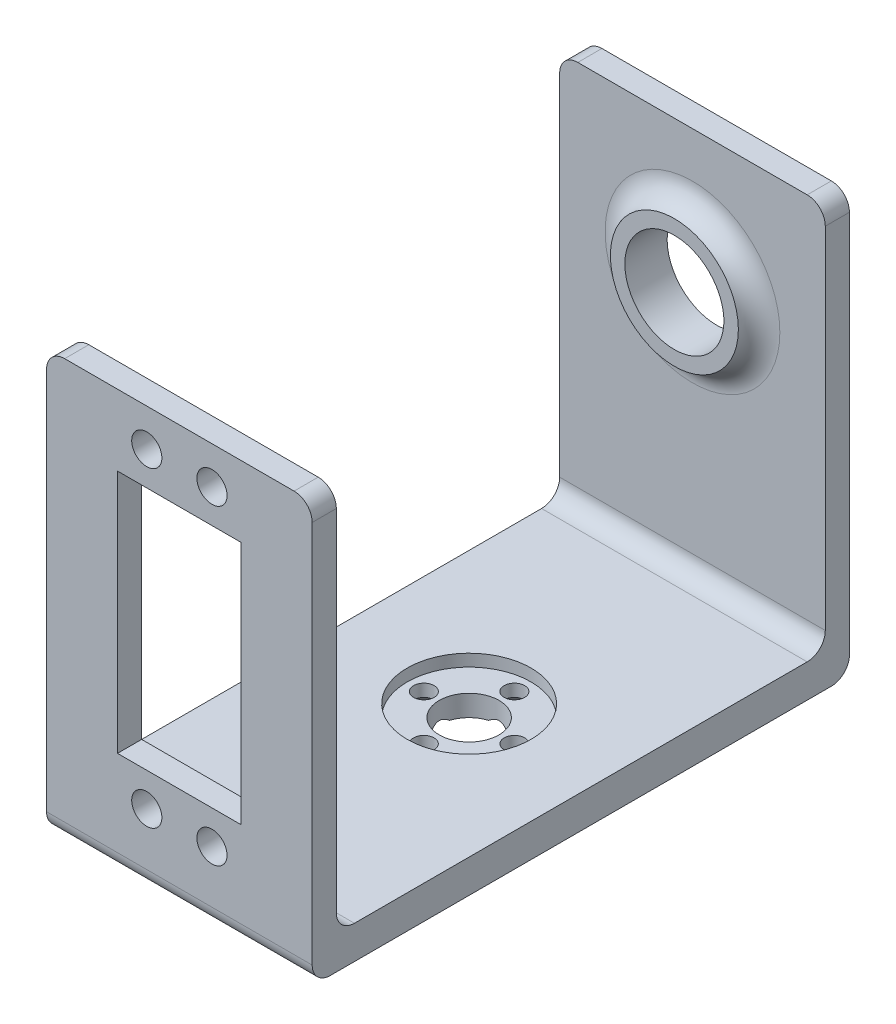
from build123d import *

# Parameters (mm, degrees)
BOSS_EXTRU_1_START                             = -3
ESQUISSE1_W                                    = 44
ESQUISSE1_H                                    = 64
ESQUISSE1_W_2                                  = 20.5
ESQUISSE1_H_2                                  = 40.5
BOSS_EXTRU_1_DEPTH                             = 4
BOSS_EXTRU_2_DEPTH                             = 44
ENL_V_MAT_EXTRU_1_REACH                        = 103.741
ESQUISSE3_R                                    = 8.2
ESQUISSE4_R                                    = 10.6
ESQUISSE4_R_2                                  = 8.2
BOSS_EXTRU_3_DEPTH                             = 3
CONG_1_R                                       = 4
CONG_2_R                                       = 3
ENL_V_MAT_EXTRU_2_REACH                        = 100.261
ESQUISSE5_R                                    = 2.5
ENL_V_START                                    = -2
ESQUISSE6_R                                    = 10.25
ENL_V_MAT_EXTRU_3_DEPTH                        = 2
ENL_V_MAT_EXTRU_4_REACH                        = 121.659
ESQUISSE7_R                                    = 4.95
FRAISAGE_POUR_VIS_T_TE_FRAIS_E_M31_D           = 3.4
FRAISAGE_POUR_VIS_T_TE_FRAIS_E_M31_CSINK_D     = 6.3
FRAISAGE_POUR_VIS_T_TE_FRAIS_E_M31_CSINK_ANGLE = 90


with BuildPart() as part:
    # Esquisse1 → Boss.-Extru.1 (new body)
    with BuildSketch(Plane.XY.offset(BOSS_EXTRU_1_START)):
        with Locations((-10, 0)):
            Rectangle(ESQUISSE1_W, ESQUISSE1_H)
        with Locations((-10, 0)):
            Rectangle(ESQUISSE1_W_2, ESQUISSE1_H_2, mode=Mode.SUBTRACT)
    extrude(amount=-BOSS_EXTRU_1_DEPTH)

    # Esquisse2 → Boss.-Extru.2 (add)
    with BuildSketch(Plane(origin=(12, 0, 0), x_dir=(0, 0, -1), z_dir=(1, 0, 0))):
        Polygon((3, -37.5), (92, -37.5), (92, 32), (88, 32), (88, -32), (7, -32), (7, -28.443383769), (3, -28.443383769), (3, -32), align=None)
    extrude(amount=-BOSS_EXTRU_2_DEPTH)

    # Esquisse3 → Enlèv. mat.-Extru.1 (cut, up to next)
    with BuildSketch(Plane(origin=(0, 0, -92), x_dir=(-1, 0, 0), z_dir=(0, 0, -1)), mode=Mode.PRIVATE) as enl_v_mat_extru_1_sk1:
        with Locations((10, 10)):
            Circle(ESQUISSE3_R)
    enl_v_mat_extru_1_tool1 = extrude(enl_v_mat_extru_1_sk1.sketch, amount=-ENL_V_MAT_EXTRU_1_REACH, mode=Mode.PRIVATE) & part.part
    add(enl_v_mat_extru_1_tool1.solids().sort_by_distance((-10, 10, -92))[0], mode=Mode.SUBTRACT)

    # Esquisse4 → Boss.-Extru.3 (add)
    with BuildSketch(Plane.XY.offset(-88)):
        with Locations((-10, 10)):
            Circle(ESQUISSE4_R)
        with Locations(Location((-10, 10, 0), (0, 0, 180))):
            Circle(ESQUISSE4_R_2, mode=Mode.SUBTRACT)
    extrude(amount=BOSS_EXTRU_3_DEPTH)

    # Congé1
    # the kernel refuses this fillet: 4 mm, written as the material it adds along each edge
    with BuildSketch(Plane(origin=(-10, 10, -88), x_dir=(1, 0, 0), z_dir=(0, -1, 0))) as cong_1_piece_1:
        with BuildLine():
            CenterArc((14.472983346, 4), CONG_1_R, 194.477512186, 75.522487814)
            Line((10.6, 3), (10.522540333, 2.98))
            ThreePointArc((10.522540333, 2.98), (10.52, 1.5), (10.52, 0))
            Line((10.52, 0), (10.6, -0.08))
            Line((10.6, -0.08), (14.472983346, -0.08))
            Line((14.472983346, -0.08), (14.472983346, 0))
        make_face()
    revolve(axis=Axis((-10, 10, -88), (0, 0, 1)))

    # Congé2
    cong_2_edges = [part.edges().sort_by_distance(p)[0] for p in [
        (12, 32, -90),
        (-32, 32, -90),
        (-10, -32, -88),
        (-10, -37.5, -3),
        (-10, -37.5, -92),
        (-10, -32, -7),
        (-32, 32, -5),
        (12, 32, -5),
    ]]
    fillet(cong_2_edges, radius=CONG_2_R)

    # Esquisse5 → Enlèv. mat.-Extru.2 (cut, up to next)
    with BuildSketch(Plane(origin=(0, 0, -7), x_dir=(-1, 0, 0), z_dir=(0, 0, -1)), mode=Mode.PRIVATE) as enl_v_mat_extru_2_sk1:
        with Locations((4.6, 25.8)):
            Circle(ESQUISSE5_R)
    enl_v_mat_extru_2_tool1 = extrude(enl_v_mat_extru_2_sk1.sketch, amount=-ENL_V_MAT_EXTRU_2_REACH, mode=Mode.PRIVATE) & part.part
    # Esquisse5 → Enlèv. mat.-Extru.2 (cut, up to next)
    with BuildSketch(Plane(origin=(0, 0, -7), x_dir=(-1, 0, 0), z_dir=(0, 0, -1)), mode=Mode.PRIVATE) as enl_v_mat_extru_2_sk2:
        with Locations((15.4, 25.8)):
            Circle(ESQUISSE5_R)
    enl_v_mat_extru_2_tool2 = extrude(enl_v_mat_extru_2_sk2.sketch, amount=-ENL_V_MAT_EXTRU_2_REACH, mode=Mode.PRIVATE) & part.part
    # Esquisse5 → Enlèv. mat.-Extru.2 (cut, up to next)
    with BuildSketch(Plane(origin=(0, 0, -7), x_dir=(-1, 0, 0), z_dir=(0, 0, -1)), mode=Mode.PRIVATE) as enl_v_mat_extru_2_sk3:
        with Locations((4.6, -25.8)):
            Circle(ESQUISSE5_R)
    enl_v_mat_extru_2_tool3 = extrude(enl_v_mat_extru_2_sk3.sketch, amount=-ENL_V_MAT_EXTRU_2_REACH, mode=Mode.PRIVATE) & part.part
    # Esquisse5 → Enlèv. mat.-Extru.2 (cut, up to next)
    with BuildSketch(Plane(origin=(0, 0, -7), x_dir=(-1, 0, 0), z_dir=(0, 0, -1)), mode=Mode.PRIVATE) as enl_v_mat_extru_2_sk4:
        with Locations((15.4, -25.8)):
            Circle(ESQUISSE5_R)
    enl_v_mat_extru_2_tool4 = extrude(enl_v_mat_extru_2_sk4.sketch, amount=-ENL_V_MAT_EXTRU_2_REACH, mode=Mode.PRIVATE) & part.part
    add(enl_v_mat_extru_2_tool1.solids().sort_by_distance((-4.6, 25.8, -7))[0], mode=Mode.SUBTRACT)
    add(enl_v_mat_extru_2_tool2.solids().sort_by_distance((-15.4, 25.8, -7))[0], mode=Mode.SUBTRACT)
    add(enl_v_mat_extru_2_tool3.solids().sort_by_distance((-4.6, -25.8, -7))[0], mode=Mode.SUBTRACT)
    add(enl_v_mat_extru_2_tool4.solids().sort_by_distance((-15.4, -25.8, -7))[0], mode=Mode.SUBTRACT)

    # Esquisse6 → Enlèv. mat.-Extru.3 (cut)
    with BuildSketch(Plane(origin=(0, -32, 0), x_dir=(1, 0, 0), z_dir=(0, 1, 0)).offset(ENL_V_START)):
        with Locations(Location((-10, 51, 0), (0, 0, 270))):
            Circle(ESQUISSE6_R)
    extrude(amount=ENL_V_MAT_EXTRU_3_DEPTH, mode=Mode.SUBTRACT)

    # Esquisse7 → Enlèv. mat.-Extru.4 (cut, up to next)
    with BuildSketch(Plane.XZ.offset(37.5), mode=Mode.PRIVATE) as enl_v_mat_extru_4_sk1:
        with Locations(Location((-10, -51, 0), (0, 0, 270))):
            Circle(ESQUISSE7_R)
    enl_v_mat_extru_4_tool1 = extrude(enl_v_mat_extru_4_sk1.sketch, amount=-ENL_V_MAT_EXTRU_4_REACH, mode=Mode.PRIVATE) & part.part
    add(enl_v_mat_extru_4_tool1.solids().sort_by_distance((-10, -37.5, -51))[0], mode=Mode.SUBTRACT)

    # Fraisage pour vis à tête fraisée M31 (through all)
    with Locations(Plane(origin=(0, -37.5, 0), x_dir=(-1, 0, 0), z_dir=(0, -1, 0))):
        with Locations((10, 58.5), (17.5, 51), (10, 43.5), (2.5, 51)):
            CounterSinkHole(FRAISAGE_POUR_VIS_T_TE_FRAIS_E_M31_D / 2, FRAISAGE_POUR_VIS_T_TE_FRAIS_E_M31_CSINK_D / 2, counter_sink_angle=FRAISAGE_POUR_VIS_T_TE_FRAIS_E_M31_CSINK_ANGLE)


solid = part.part
